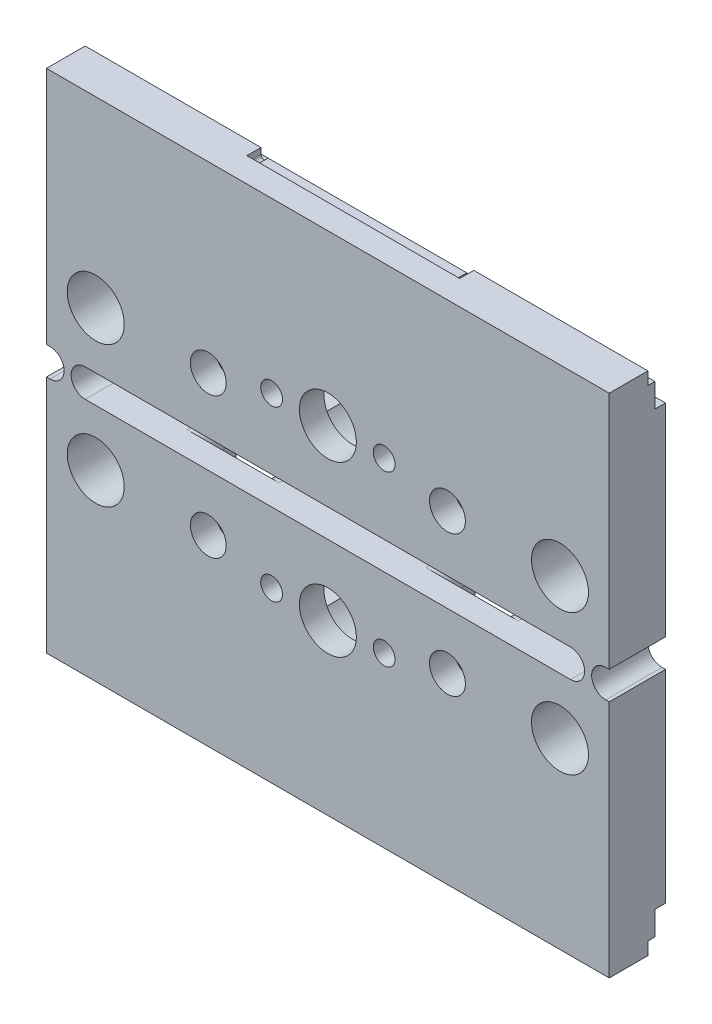
from build123d import *

# Parameters (mm, degrees)
SKETCH_2_W           = 80
SKETCH_2_H           = 34
SKETCH_2_R           = 4.05
EXTRUDE_1_DEPTH      = 8
SKETCH_3_R           = 2.55
CUT_EXTRUDE_1_DEPTH  = 88.292611371
CUT_EXTRUDE_2_DEPTH  = 88.292611371
SKETCH_5_R           = 1.55
CUT_EXTRUDE_3_DEPTH  = 88.292611371
CUT_EXTRUDE_4_DEPTH  = 4.5
CUT_EXTRUDE_5_DEPTH  = 4.5
SKETCH_20_R          = 5.5
CUT_EXTRUDE_12_DEPTH = 4.5
CUT_EXTRUDE_11_DEPTH = 2
EXTRUDE_2_DEPTH      = 8


with BuildPart() as part:
    # 草图2 → 凸台-拉伸1 (new body)
    with BuildSketch(Plane.XY):
        with Locations((40, 17)):
            Rectangle(SKETCH_2_W, SKETCH_2_H)
        with Locations((7, 8)):
            Circle(SKETCH_2_R, mode=Mode.SUBTRACT)
        with Locations((40, 10)):
            Circle(SKETCH_2_R, mode=Mode.SUBTRACT)
        with Locations((73, 8)):
            Circle(SKETCH_2_R, mode=Mode.SUBTRACT)
    extrude_1 = extrude(amount=EXTRUDE_1_DEPTH)

    # 草图3 → 切除-拉伸1 (cut, through all)
    with BuildSketch(Plane.XY.offset(8)):
        with Locations((23, 8)):
            Circle(SKETCH_3_R)
        with Locations((57, 8)):
            Circle(SKETCH_3_R)
    cut_extrude_1 = extrude(amount=-CUT_EXTRUDE_1_DEPTH, mode=Mode.SUBTRACT)

    # 草图4 → 切除-拉伸2 (cut, through all)
    with BuildSketch(Plane(origin=(80, 0, 0), x_dir=(0, 0, -1), z_dir=(1, 0, 0))):
        Polygon((-1.5, 32.2), (-2.5, 32.2), (-2.5, 34), (0, 34), (0, 28.8), (-1.5, 28.8), align=None)
    cut_extrude_2 = extrude(amount=-CUT_EXTRUDE_2_DEPTH, mode=Mode.SUBTRACT)

    # 草图5 → 切除-拉伸3 (cut, through all)
    with BuildSketch(Plane.XY.offset(8)):
        with Locations((48, 10)):
            Circle(SKETCH_5_R)
        with Locations((32, 10)):
            Circle(SKETCH_5_R)
    cut_extrude_3 = extrude(amount=-CUT_EXTRUDE_3_DEPTH, mode=Mode.SUBTRACT)

    # 草图7 → 切除-拉伸4 (cut)
    with BuildSketch(Plane(origin=(0, 0, 0), x_dir=(-1, 0, 0), z_dir=(0, 0, -1))):
        with BuildLine():
            Line((-27.05, 10), (-27.05, 2.5))
            ThreePointArc((-27.05, 2.5), (-27.782233047, 0.732233047), (-29.55, 0))
            Line((-29.55, 0), (-16.45, 0))
            ThreePointArc((-16.45, 0), (-18.217766953, 0.732233047), (-18.95, 2.5))
            Line((-18.95, 2.5), (-18.95, 10))
            ThreePointArc((-18.95, 10), (-23, 14.05), (-27.05, 10))
        make_face()
        with BuildLine():
            Line((-61.05, 2.5), (-61.05, 10))
            ThreePointArc((-61.05, 10), (-57, 14.05), (-52.95, 10))
            Line((-52.95, 10), (-52.95, 2.5))
            ThreePointArc((-52.95, 2.5), (-52.217766953, 0.732233047), (-50.45, 0))
            Line((-50.45, 0), (-63.55, 0))
            ThreePointArc((-63.55, 0), (-61.782233047, 0.732233047), (-61.05, 2.5))
        make_face()
    cut_extrude_4 = extrude(amount=-CUT_EXTRUDE_4_DEPTH, mode=Mode.SUBTRACT)

    # 草图8 → 切除-拉伸5 (cut)
    with BuildSketch(Plane(origin=(0, 0, 0), x_dir=(-1, 0, 0), z_dir=(0, 0, -1))):
        with BuildLine():
            Line((-30.5, 12.85), (-49.5, 12.85))
            ThreePointArc((-49.5, 12.85), (-52.35, 10), (-49.5, 7.15))
            Line((-49.5, 7.15), (-30.5, 7.15))
            ThreePointArc((-30.5, 7.15), (-27.65, 10), (-30.5, 12.85))
        make_face()
    cut_extrude_5 = extrude(amount=-CUT_EXTRUDE_5_DEPTH, mode=Mode.SUBTRACT)

    # 草图20 → 切除-拉伸12 (cut)
    with BuildSketch(Plane(origin=(0, 0, 0), x_dir=(-1, 0, 0), z_dir=(0, 0, -1))):
        with Locations((-40, 10)):
            Circle(SKETCH_20_R)
    cut_extrude_12 = extrude(amount=-CUT_EXTRUDE_12_DEPTH, mode=Mode.SUBTRACT)

    # 草图19 → 切除-拉伸11 (cut)
    with BuildSketch(Plane(origin=(0, 0, 2.5), x_dir=(-1, 0, 0), z_dir=(0, 0, -1))):
        with BuildLine():
            Line((-25, 34), (-55.247938178, 34))
            Line((-55.247938178, 34), (-55.247938178, 33.2))
            ThreePointArc((-55.247938178, 33.2), (-54.747938178, 32.7), (-54.247938178, 33.2))
            Line((-54.247938178, 33.2), (-26, 33.2))
            ThreePointArc((-26, 33.2), (-25.5, 32.7), (-25, 33.2))
            Line((-25, 33.2), (-25, 34))
        make_face()
    cut_extrude_11 = extrude(amount=-CUT_EXTRUDE_11_DEPTH, mode=Mode.SUBTRACT)

    # 草图22 → 凸台-拉伸2 (add)
    with BuildSketch(Plane.XY.offset(8)):
        with BuildLine():
            Line((0.5, -4), (5.5, -4))
            ThreePointArc((5.5, -4), (3.5, -2), (5.5, 0))
            Line((5.5, 0), (0.5, 0))
            ThreePointArc((0.5, 0), (2.5, -2), (0.5, -4))
        make_face()
        with BuildLine():
            Line((79.5, 0), (74.5, 0))
            ThreePointArc((74.5, 0), (76.5, -2), (74.5, -4))
            Line((74.5, -4), (79.5, -4))
            ThreePointArc((79.5, -4), (77.5, -2), (79.5, 0))
        make_face()
    extrude(amount=-EXTRUDE_2_DEPTH)

    # 镜向2: 凸台-拉伸1, 切除-拉伸1, 切除-拉伸2, 切除-拉伸3, 切除-拉伸4, 切除-拉伸5, 切除-拉伸12, 切除-拉伸11 across plane
    add(extrude_1.mirror(Plane(origin=(0, -2, 0), x_dir=(0, 0, 1), z_dir=(0, -1, 0))))
    add(cut_extrude_1.mirror(Plane(origin=(0, -2, 0), x_dir=(0, 0, 1), z_dir=(0, -1, 0))), mode=Mode.SUBTRACT)
    add(cut_extrude_2.mirror(Plane(origin=(0, -2, 0), x_dir=(0, 0, 1), z_dir=(0, -1, 0))), mode=Mode.SUBTRACT)
    add(cut_extrude_3.mirror(Plane(origin=(0, -2, 0), x_dir=(0, 0, 1), z_dir=(0, -1, 0))), mode=Mode.SUBTRACT)
    add(cut_extrude_4.mirror(Plane(origin=(0, -2, 0), x_dir=(0, 0, 1), z_dir=(0, -1, 0))), mode=Mode.SUBTRACT)
    add(cut_extrude_5.mirror(Plane(origin=(0, -2, 0), x_dir=(0, 0, 1), z_dir=(0, -1, 0))), mode=Mode.SUBTRACT)
    add(cut_extrude_12.mirror(Plane(origin=(0, -2, 0), x_dir=(0, 0, 1), z_dir=(0, -1, 0))), mode=Mode.SUBTRACT)
    add(cut_extrude_11.mirror(Plane(origin=(0, -2, 0), x_dir=(0, 0, 1), z_dir=(0, -1, 0))), mode=Mode.SUBTRACT)


solid = part.part
